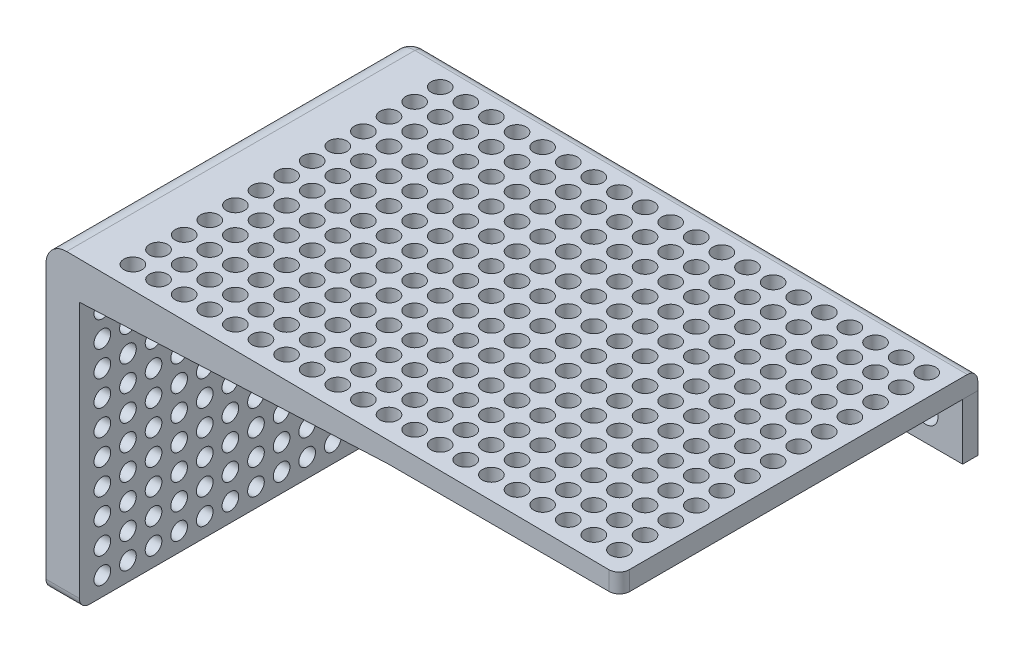
from build123d import *

# Parameters (mm, degrees)
BOSS_EXTRUDE1_DEPTH = 3.81
SKETCH3_R           = 3.048
CUT_EXTRUDE1_DEPTH  = 5.08
BOSS_EXTRUDE3_DEPTH = 88.9
SKETCH13_R          = 2.066220198
CUT_EXTRUDE5_DEPTH  = 8.382
FILLET1_R           = 5.08
SKETCH11_W          = 17.734275282
SKETCH11_H          = 29.748307676
SKETCH11_H_2        = 6.473099961
CUT_EXTRUDE6_DEPTH  = 8.382
FILLET2_R           = 2.54
SKETCH12_R          = 2.251335549
CUT_EXTRUDE8_DEPTH  = 10.668


with BuildPart() as part:
    # Sketch2 → Boss-Extrude1 (new body)
    with BuildSketch(Plane.XY):
        Polygon((0, 0), (19.05, 0), (19.05, 48.381202876), (76.506116443, 55.792162409), (133.961624595, 55.792162409), (133.961624595, 69.711099336), (76.506116443, 69.711099336), (0, 66.161202876), align=None)
    extrude(amount=BOSS_EXTRUDE1_DEPTH)

    # Sketch3 → Cut-Extrude1 (cut)
    with BuildSketch(Plane.XY.offset(3.81)):
        with Locations((12.573, 55.590515547)):
            Circle(SKETCH3_R)
        with Locations((68.406077338, 61.559515547)):
            Circle(SKETCH3_R)
        with Locations((9.525, 12.283515547)):
            Circle(SKETCH3_R)
        with Locations((124.794077338, 62.829515547)):
            Circle(SKETCH3_R)
    extrude(amount=-CUT_EXTRUDE1_DEPTH, mode=Mode.SUBTRACT)

    # Sketch11 → Cut-Extrude6 (cut)
    with BuildSketch(Plane.XY.offset(3.81)):
        with Locations((10.182862359, 33.507049038)):
            Rectangle(SKETCH11_W, SKETCH11_H)
        with Locations((10.182862359, 3.236549981)):
            Rectangle(SKETCH11_W, SKETCH11_H_2)
    extrude(amount=-CUT_EXTRUDE6_DEPTH, mode=Mode.SUBTRACT)


with BuildPart() as body_2:
    # Sketch6 → Boss-Extrude3 (new body)
    with BuildSketch(Plane(origin=(0, 0, 0), x_dir=(-1, 0, 0), z_dir=(0, 0, -1))):
        Polygon((0, 66.161202876), (0, 0), (8.252290324, 0), (8.252290324, 75.514615039), (-133.836505972, 74.357932411), (-133.961624595, 69.711099336), (-76.506116443, 69.711099336), align=None)
    extrude(amount=-BOSS_EXTRUDE3_DEPTH)

    # Sketch13 → Cut-Extrude5 (cut)
    with BuildSketch(Plane.ZY.offset(8.252290324)):
        with Locations((6.984688979, 4.65519234)):
            Circle(SKETCH13_R)
        with Locations((13.334688979, 4.65519234)):
            Circle(SKETCH13_R)
        with Locations((19.684688979, 4.65519234)):
            Circle(SKETCH13_R)
        with Locations((26.034688979, 4.65519234)):
            Circle(SKETCH13_R)
        with Locations((32.384688979, 4.65519234)):
            Circle(SKETCH13_R)
        with Locations((38.734688979, 4.65519234)):
            Circle(SKETCH13_R)
        with Locations((45.084688979, 4.65519234)):
            Circle(SKETCH13_R)
        with Locations((51.434688979, 4.65519234)):
            Circle(SKETCH13_R)
        with Locations((57.784688979, 4.65519234)):
            Circle(SKETCH13_R)
        with Locations((64.134688979, 4.65519234)):
            Circle(SKETCH13_R)
        with Locations((70.484688979, 4.65519234)):
            Circle(SKETCH13_R)
        with Locations((76.834688979, 4.65519234)):
            Circle(SKETCH13_R)
        with Locations((83.184688979, 4.65519234)):
            Circle(SKETCH13_R)
        with Locations((13.334688979, 11.00519234)):
            Circle(SKETCH13_R)
        with Locations((19.684688979, 11.00519234)):
            Circle(SKETCH13_R)
        with Locations((26.034688979, 11.00519234)):
            Circle(SKETCH13_R)
        with Locations((32.384688979, 11.00519234)):
            Circle(SKETCH13_R)
        with Locations((38.734688979, 11.00519234)):
            Circle(SKETCH13_R)
        with Locations((45.084688979, 11.00519234)):
            Circle(SKETCH13_R)
        with Locations((51.434688979, 11.00519234)):
            Circle(SKETCH13_R)
        with Locations((57.784688979, 11.00519234)):
            Circle(SKETCH13_R)
        with Locations((64.134688979, 11.00519234)):
            Circle(SKETCH13_R)
        with Locations((70.484688979, 11.00519234)):
            Circle(SKETCH13_R)
        with Locations((76.834688979, 11.00519234)):
            Circle(SKETCH13_R)
        with Locations((83.184688979, 11.00519234)):
            Circle(SKETCH13_R)
        with Locations((13.334688979, 17.35519234)):
            Circle(SKETCH13_R)
        with Locations((19.684688979, 17.35519234)):
            Circle(SKETCH13_R)
        with Locations((26.034688979, 17.35519234)):
            Circle(SKETCH13_R)
        with Locations((32.384688979, 17.35519234)):
            Circle(SKETCH13_R)
        with Locations((38.734688979, 17.35519234)):
            Circle(SKETCH13_R)
        with Locations((45.084688979, 17.35519234)):
            Circle(SKETCH13_R)
        with Locations((51.434688979, 17.35519234)):
            Circle(SKETCH13_R)
        with Locations((57.784688979, 17.35519234)):
            Circle(SKETCH13_R)
        with Locations((64.134688979, 17.35519234)):
            Circle(SKETCH13_R)
        with Locations((70.484688979, 17.35519234)):
            Circle(SKETCH13_R)
        with Locations((76.834688979, 17.35519234)):
            Circle(SKETCH13_R)
        with Locations((83.184688979, 17.35519234)):
            Circle(SKETCH13_R)
        with Locations((13.334688979, 23.70519234)):
            Circle(SKETCH13_R)
        with Locations((19.684688979, 23.70519234)):
            Circle(SKETCH13_R)
        with Locations((26.034688979, 23.70519234)):
            Circle(SKETCH13_R)
        with Locations((32.384688979, 23.70519234)):
            Circle(SKETCH13_R)
        with Locations((38.734688979, 23.70519234)):
            Circle(SKETCH13_R)
        with Locations((45.084688979, 23.70519234)):
            Circle(SKETCH13_R)
        with Locations((51.434688979, 23.70519234)):
            Circle(SKETCH13_R)
        with Locations((57.784688979, 23.70519234)):
            Circle(SKETCH13_R)
        with Locations((64.134688979, 23.70519234)):
            Circle(SKETCH13_R)
        with Locations((70.484688979, 23.70519234)):
            Circle(SKETCH13_R)
        with Locations((76.834688979, 23.70519234)):
            Circle(SKETCH13_R)
        with Locations((83.184688979, 23.70519234)):
            Circle(SKETCH13_R)
        with Locations((13.334688979, 30.05519234)):
            Circle(SKETCH13_R)
        with Locations((19.684688979, 30.05519234)):
            Circle(SKETCH13_R)
        with Locations((26.034688979, 30.05519234)):
            Circle(SKETCH13_R)
        with Locations((32.384688979, 30.05519234)):
            Circle(SKETCH13_R)
        with Locations((38.734688979, 30.05519234)):
            Circle(SKETCH13_R)
        with Locations((45.084688979, 30.05519234)):
            Circle(SKETCH13_R)
        with Locations((51.434688979, 30.05519234)):
            Circle(SKETCH13_R)
        with Locations((57.784688979, 30.05519234)):
            Circle(SKETCH13_R)
        with Locations((64.134688979, 30.05519234)):
            Circle(SKETCH13_R)
        with Locations((70.484688979, 30.05519234)):
            Circle(SKETCH13_R)
        with Locations((76.834688979, 30.05519234)):
            Circle(SKETCH13_R)
        with Locations((83.184688979, 30.05519234)):
            Circle(SKETCH13_R)
        with Locations((13.334688979, 36.40519234)):
            Circle(SKETCH13_R)
        with Locations((19.684688979, 36.40519234)):
            Circle(SKETCH13_R)
        with Locations((26.034688979, 36.40519234)):
            Circle(SKETCH13_R)
        with Locations((32.384688979, 36.40519234)):
            Circle(SKETCH13_R)
        with Locations((38.734688979, 36.40519234)):
            Circle(SKETCH13_R)
        with Locations((45.084688979, 36.40519234)):
            Circle(SKETCH13_R)
        with Locations((51.434688979, 36.40519234)):
            Circle(SKETCH13_R)
        with Locations((57.784688979, 36.40519234)):
            Circle(SKETCH13_R)
        with Locations((64.134688979, 36.40519234)):
            Circle(SKETCH13_R)
        with Locations((70.484688979, 36.40519234)):
            Circle(SKETCH13_R)
        with Locations((76.834688979, 36.40519234)):
            Circle(SKETCH13_R)
        with Locations((83.184688979, 36.40519234)):
            Circle(SKETCH13_R)
        with Locations((13.334688979, 42.75519234)):
            Circle(SKETCH13_R)
        with Locations((19.684688979, 42.75519234)):
            Circle(SKETCH13_R)
        with Locations((26.034688979, 42.75519234)):
            Circle(SKETCH13_R)
        with Locations((32.384688979, 42.75519234)):
            Circle(SKETCH13_R)
        with Locations((38.734688979, 42.75519234)):
            Circle(SKETCH13_R)
        with Locations((45.084688979, 42.75519234)):
            Circle(SKETCH13_R)
        with Locations((51.434688979, 42.75519234)):
            Circle(SKETCH13_R)
        with Locations((57.784688979, 42.75519234)):
            Circle(SKETCH13_R)
        with Locations((64.134688979, 42.75519234)):
            Circle(SKETCH13_R)
        with Locations((70.484688979, 42.75519234)):
            Circle(SKETCH13_R)
        with Locations((76.834688979, 42.75519234)):
            Circle(SKETCH13_R)
        with Locations((83.184688979, 42.75519234)):
            Circle(SKETCH13_R)
        with Locations((13.334688979, 49.10519234)):
            Circle(SKETCH13_R)
        with Locations((19.684688979, 49.10519234)):
            Circle(SKETCH13_R)
        with Locations((26.034688979, 49.10519234)):
            Circle(SKETCH13_R)
        with Locations((32.384688979, 49.10519234)):
            Circle(SKETCH13_R)
        with Locations((38.734688979, 49.10519234)):
            Circle(SKETCH13_R)
        with Locations((45.084688979, 49.10519234)):
            Circle(SKETCH13_R)
        with Locations((51.434688979, 49.10519234)):
            Circle(SKETCH13_R)
        with Locations((57.784688979, 49.10519234)):
            Circle(SKETCH13_R)
        with Locations((64.134688979, 49.10519234)):
            Circle(SKETCH13_R)
        with Locations((70.484688979, 49.10519234)):
            Circle(SKETCH13_R)
        with Locations((76.834688979, 49.10519234)):
            Circle(SKETCH13_R)
        with Locations((83.184688979, 49.10519234)):
            Circle(SKETCH13_R)
        with Locations((13.334688979, 55.45519234)):
            Circle(SKETCH13_R)
        with Locations((19.684688979, 55.45519234)):
            Circle(SKETCH13_R)
        with Locations((26.034688979, 55.45519234)):
            Circle(SKETCH13_R)
        with Locations((32.384688979, 55.45519234)):
            Circle(SKETCH13_R)
        with Locations((38.734688979, 55.45519234)):
            Circle(SKETCH13_R)
        with Locations((45.084688979, 55.45519234)):
            Circle(SKETCH13_R)
        with Locations((51.434688979, 55.45519234)):
            Circle(SKETCH13_R)
        with Locations((57.784688979, 55.45519234)):
            Circle(SKETCH13_R)
        with Locations((64.134688979, 55.45519234)):
            Circle(SKETCH13_R)
        with Locations((70.484688979, 55.45519234)):
            Circle(SKETCH13_R)
        with Locations((76.834688979, 55.45519234)):
            Circle(SKETCH13_R)
        with Locations((83.184688979, 55.45519234)):
            Circle(SKETCH13_R)
        with Locations((13.334688979, 61.80519234)):
            Circle(SKETCH13_R)
        with Locations((19.684688979, 61.80519234)):
            Circle(SKETCH13_R)
        with Locations((26.034688979, 61.80519234)):
            Circle(SKETCH13_R)
        with Locations((32.384688979, 61.80519234)):
            Circle(SKETCH13_R)
        with Locations((38.734688979, 61.80519234)):
            Circle(SKETCH13_R)
        with Locations((45.084688979, 61.80519234)):
            Circle(SKETCH13_R)
        with Locations((51.434688979, 61.80519234)):
            Circle(SKETCH13_R)
        with Locations((57.784688979, 61.80519234)):
            Circle(SKETCH13_R)
        with Locations((64.134688979, 61.80519234)):
            Circle(SKETCH13_R)
        with Locations((70.484688979, 61.80519234)):
            Circle(SKETCH13_R)
        with Locations((76.834688979, 61.80519234)):
            Circle(SKETCH13_R)
        with Locations((83.184688979, 61.80519234)):
            Circle(SKETCH13_R)
        with Locations((6.984688979, 11.00519234)):
            Circle(SKETCH13_R)
        with Locations((6.984688979, 17.35519234)):
            Circle(SKETCH13_R)
        with Locations((6.984688979, 23.70519234)):
            Circle(SKETCH13_R)
        with Locations((6.984688979, 30.05519234)):
            Circle(SKETCH13_R)
        with Locations((6.984688979, 36.40519234)):
            Circle(SKETCH13_R)
        with Locations((6.984688979, 42.75519234)):
            Circle(SKETCH13_R)
        with Locations((6.984688979, 49.10519234)):
            Circle(SKETCH13_R)
        with Locations((6.984688979, 55.45519234)):
            Circle(SKETCH13_R)
        with Locations((6.984688979, 61.80519234)):
            Circle(SKETCH13_R)
    extrude(amount=-CUT_EXTRUDE5_DEPTH, mode=Mode.SUBTRACT)

    # Fillet1
    fillet1_edges = [body_2.edges().sort_by_distance(p)[0] for p in [
        (-8.252290324, 75.514615039, 44.45),
    ]]
    fillet(fillet1_edges, radius=FILLET1_R)

    # Fillet2
    fillet2_edges = [body_2.edges().sort_by_distance(p)[0] for p in [
        (-8.252290324, 35.196546333, 0),
        (-6.749742516, 73.999785862, 0),
        (-4.126145162, 0, 88.9),
        (65.352784166, 74.915428381, 0),
        (133.899065284, 72.034515873, 88.9),
    ]]
    fillet(fillet2_edges, radius=FILLET2_R)

    # Sketch12 → Cut-Extrude8 (cut)
    with BuildSketch(Plane(origin=(0.614143824, 75.442437284, 0), x_dir=(0.9999668672734643, -0.0081402920889802, 0), z_dir=(0.0081402920889802, 0.9999668672734644, 0))):
        with Locations((127.816375398, -7.177579688)):
            Circle(SKETCH12_R)
        with Locations((121.466375398, -7.177579688)):
            Circle(SKETCH12_R)
        with Locations((115.116375398, -7.177579688)):
            Circle(SKETCH12_R)
        with Locations((108.766375398, -7.177579688)):
            Circle(SKETCH12_R)
        with Locations((102.416375398, -7.177579688)):
            Circle(SKETCH12_R)
        with Locations((96.066375398, -7.177579688)):
            Circle(SKETCH12_R)
        with Locations((89.716375398, -7.177579688)):
            Circle(SKETCH12_R)
        with Locations((83.366375398, -7.177579688)):
            Circle(SKETCH12_R)
        with Locations((77.016375398, -7.177579688)):
            Circle(SKETCH12_R)
        with Locations((70.666375398, -7.177579688)):
            Circle(SKETCH12_R)
        with Locations((64.316375398, -7.177579688)):
            Circle(SKETCH12_R)
        with Locations((57.966375398, -7.177579688)):
            Circle(SKETCH12_R)
        with Locations((51.616375398, -7.177579688)):
            Circle(SKETCH12_R)
        with Locations((45.266375398, -7.177579688)):
            Circle(SKETCH12_R)
        with Locations((38.916375398, -7.177579688)):
            Circle(SKETCH12_R)
        with Locations((32.566375398, -7.177579688)):
            Circle(SKETCH12_R)
        with Locations((26.216375398, -7.177579688)):
            Circle(SKETCH12_R)
        with Locations((19.866375398, -7.177579688)):
            Circle(SKETCH12_R)
        with Locations((13.516375398, -7.177579688)):
            Circle(SKETCH12_R)
        with Locations((7.166375398, -7.177579688)):
            Circle(SKETCH12_R)
        with Locations((121.466375398, -13.527579688)):
            Circle(SKETCH12_R)
        with Locations((115.116375398, -13.527579688)):
            Circle(SKETCH12_R)
        with Locations((108.766375398, -13.527579688)):
            Circle(SKETCH12_R)
        with Locations((102.416375398, -13.527579688)):
            Circle(SKETCH12_R)
        with Locations((96.066375398, -13.527579688)):
            Circle(SKETCH12_R)
        with Locations((89.716375398, -13.527579688)):
            Circle(SKETCH12_R)
        with Locations((83.366375398, -13.527579688)):
            Circle(SKETCH12_R)
        with Locations((77.016375398, -13.527579688)):
            Circle(SKETCH12_R)
        with Locations((70.666375398, -13.527579688)):
            Circle(SKETCH12_R)
        with Locations((64.316375398, -13.527579688)):
            Circle(SKETCH12_R)
        with Locations((57.966375398, -13.527579688)):
            Circle(SKETCH12_R)
        with Locations((51.616375398, -13.527579688)):
            Circle(SKETCH12_R)
        with Locations((45.266375398, -13.527579688)):
            Circle(SKETCH12_R)
        with Locations((38.916375398, -13.527579688)):
            Circle(SKETCH12_R)
        with Locations((32.566375398, -13.527579688)):
            Circle(SKETCH12_R)
        with Locations((26.216375398, -13.527579688)):
            Circle(SKETCH12_R)
        with Locations((19.866375398, -13.527579688)):
            Circle(SKETCH12_R)
        with Locations((13.516375398, -13.527579688)):
            Circle(SKETCH12_R)
        with Locations((7.166375398, -13.527579688)):
            Circle(SKETCH12_R)
        with Locations((121.466375398, -19.877579688)):
            Circle(SKETCH12_R)
        with Locations((115.116375398, -19.877579688)):
            Circle(SKETCH12_R)
        with Locations((108.766375398, -19.877579688)):
            Circle(SKETCH12_R)
        with Locations((102.416375398, -19.877579688)):
            Circle(SKETCH12_R)
        with Locations((96.066375398, -19.877579688)):
            Circle(SKETCH12_R)
        with Locations((89.716375398, -19.877579688)):
            Circle(SKETCH12_R)
        with Locations((83.366375398, -19.877579688)):
            Circle(SKETCH12_R)
        with Locations((77.016375398, -19.877579688)):
            Circle(SKETCH12_R)
        with Locations((70.666375398, -19.877579688)):
            Circle(SKETCH12_R)
        with Locations((64.316375398, -19.877579688)):
            Circle(SKETCH12_R)
        with Locations((57.966375398, -19.877579688)):
            Circle(SKETCH12_R)
        with Locations((51.616375398, -19.877579688)):
            Circle(SKETCH12_R)
        with Locations((45.266375398, -19.877579688)):
            Circle(SKETCH12_R)
        with Locations((38.916375398, -19.877579688)):
            Circle(SKETCH12_R)
        with Locations((32.566375398, -19.877579688)):
            Circle(SKETCH12_R)
        with Locations((26.216375398, -19.877579688)):
            Circle(SKETCH12_R)
        with Locations((19.866375398, -19.877579688)):
            Circle(SKETCH12_R)
        with Locations((13.516375398, -19.877579688)):
            Circle(SKETCH12_R)
        with Locations((7.166375398, -19.877579688)):
            Circle(SKETCH12_R)
        with Locations((121.466375398, -26.227579688)):
            Circle(SKETCH12_R)
        with Locations((115.116375398, -26.227579688)):
            Circle(SKETCH12_R)
        with Locations((108.766375398, -26.227579688)):
            Circle(SKETCH12_R)
        with Locations((102.416375398, -26.227579688)):
            Circle(SKETCH12_R)
        with Locations((96.066375398, -26.227579688)):
            Circle(SKETCH12_R)
        with Locations((89.716375398, -26.227579688)):
            Circle(SKETCH12_R)
        with Locations((83.366375398, -26.227579688)):
            Circle(SKETCH12_R)
        with Locations((77.016375398, -26.227579688)):
            Circle(SKETCH12_R)
        with Locations((70.666375398, -26.227579688)):
            Circle(SKETCH12_R)
        with Locations((64.316375398, -26.227579688)):
            Circle(SKETCH12_R)
        with Locations((57.966375398, -26.227579688)):
            Circle(SKETCH12_R)
        with Locations((51.616375398, -26.227579688)):
            Circle(SKETCH12_R)
        with Locations((45.266375398, -26.227579688)):
            Circle(SKETCH12_R)
        with Locations((38.916375398, -26.227579688)):
            Circle(SKETCH12_R)
        with Locations((32.566375398, -26.227579688)):
            Circle(SKETCH12_R)
        with Locations((26.216375398, -26.227579688)):
            Circle(SKETCH12_R)
        with Locations((19.866375398, -26.227579688)):
            Circle(SKETCH12_R)
        with Locations((13.516375398, -26.227579688)):
            Circle(SKETCH12_R)
        with Locations((7.166375398, -26.227579688)):
            Circle(SKETCH12_R)
        with Locations((121.466375398, -32.577579688)):
            Circle(SKETCH12_R)
        with Locations((115.116375398, -32.577579688)):
            Circle(SKETCH12_R)
        with Locations((108.766375398, -32.577579688)):
            Circle(SKETCH12_R)
        with Locations((102.416375398, -32.577579688)):
            Circle(SKETCH12_R)
        with Locations((96.066375398, -32.577579688)):
            Circle(SKETCH12_R)
        with Locations((89.716375398, -32.577579688)):
            Circle(SKETCH12_R)
        with Locations((83.366375398, -32.577579688)):
            Circle(SKETCH12_R)
        with Locations((77.016375398, -32.577579688)):
            Circle(SKETCH12_R)
        with Locations((70.666375398, -32.577579688)):
            Circle(SKETCH12_R)
        with Locations((64.316375398, -32.577579688)):
            Circle(SKETCH12_R)
        with Locations((57.966375398, -32.577579688)):
            Circle(SKETCH12_R)
        with Locations((51.616375398, -32.577579688)):
            Circle(SKETCH12_R)
        with Locations((45.266375398, -32.577579688)):
            Circle(SKETCH12_R)
        with Locations((38.916375398, -32.577579688)):
            Circle(SKETCH12_R)
        with Locations((32.566375398, -32.577579688)):
            Circle(SKETCH12_R)
        with Locations((26.216375398, -32.577579688)):
            Circle(SKETCH12_R)
        with Locations((19.866375398, -32.577579688)):
            Circle(SKETCH12_R)
        with Locations((13.516375398, -32.577579688)):
            Circle(SKETCH12_R)
        with Locations((7.166375398, -32.577579688)):
            Circle(SKETCH12_R)
        with Locations((121.466375398, -38.927579688)):
            Circle(SKETCH12_R)
        with Locations((115.116375398, -38.927579688)):
            Circle(SKETCH12_R)
        with Locations((108.766375398, -38.927579688)):
            Circle(SKETCH12_R)
        with Locations((102.416375398, -38.927579688)):
            Circle(SKETCH12_R)
        with Locations((96.066375398, -38.927579688)):
            Circle(SKETCH12_R)
        with Locations((89.716375398, -38.927579688)):
            Circle(SKETCH12_R)
        with Locations((83.366375398, -38.927579688)):
            Circle(SKETCH12_R)
        with Locations((77.016375398, -38.927579688)):
            Circle(SKETCH12_R)
        with Locations((70.666375398, -38.927579688)):
            Circle(SKETCH12_R)
        with Locations((64.316375398, -38.927579688)):
            Circle(SKETCH12_R)
        with Locations((57.966375398, -38.927579688)):
            Circle(SKETCH12_R)
        with Locations((51.616375398, -38.927579688)):
            Circle(SKETCH12_R)
        with Locations((45.266375398, -38.927579688)):
            Circle(SKETCH12_R)
        with Locations((38.916375398, -38.927579688)):
            Circle(SKETCH12_R)
        with Locations((32.566375398, -38.927579688)):
            Circle(SKETCH12_R)
        with Locations((26.216375398, -38.927579688)):
            Circle(SKETCH12_R)
        with Locations((19.866375398, -38.927579688)):
            Circle(SKETCH12_R)
        with Locations((13.516375398, -38.927579688)):
            Circle(SKETCH12_R)
        with Locations((7.166375398, -38.927579688)):
            Circle(SKETCH12_R)
        with Locations((121.466375398, -45.277579688)):
            Circle(SKETCH12_R)
        with Locations((115.116375398, -45.277579688)):
            Circle(SKETCH12_R)
        with Locations((108.766375398, -45.277579688)):
            Circle(SKETCH12_R)
        with Locations((102.416375398, -45.277579688)):
            Circle(SKETCH12_R)
        with Locations((96.066375398, -45.277579688)):
            Circle(SKETCH12_R)
        with Locations((89.716375398, -45.277579688)):
            Circle(SKETCH12_R)
        with Locations((83.366375398, -45.277579688)):
            Circle(SKETCH12_R)
        with Locations((77.016375398, -45.277579688)):
            Circle(SKETCH12_R)
        with Locations((70.666375398, -45.277579688)):
            Circle(SKETCH12_R)
        with Locations((64.316375398, -45.277579688)):
            Circle(SKETCH12_R)
        with Locations((57.966375398, -45.277579688)):
            Circle(SKETCH12_R)
        with Locations((51.616375398, -45.277579688)):
            Circle(SKETCH12_R)
        with Locations((45.266375398, -45.277579688)):
            Circle(SKETCH12_R)
        with Locations((38.916375398, -45.277579688)):
            Circle(SKETCH12_R)
        with Locations((32.566375398, -45.277579688)):
            Circle(SKETCH12_R)
        with Locations((26.216375398, -45.277579688)):
            Circle(SKETCH12_R)
        with Locations((19.866375398, -45.277579688)):
            Circle(SKETCH12_R)
        with Locations((13.516375398, -45.277579688)):
            Circle(SKETCH12_R)
        with Locations((7.166375398, -45.277579688)):
            Circle(SKETCH12_R)
        with Locations((121.466375398, -51.627579688)):
            Circle(SKETCH12_R)
        with Locations((115.116375398, -51.627579688)):
            Circle(SKETCH12_R)
        with Locations((108.766375398, -51.627579688)):
            Circle(SKETCH12_R)
        with Locations((102.416375398, -51.627579688)):
            Circle(SKETCH12_R)
        with Locations((96.066375398, -51.627579688)):
            Circle(SKETCH12_R)
        with Locations((89.716375398, -51.627579688)):
            Circle(SKETCH12_R)
        with Locations((83.366375398, -51.627579688)):
            Circle(SKETCH12_R)
        with Locations((77.016375398, -51.627579688)):
            Circle(SKETCH12_R)
        with Locations((70.666375398, -51.627579688)):
            Circle(SKETCH12_R)
        with Locations((64.316375398, -51.627579688)):
            Circle(SKETCH12_R)
        with Locations((57.966375398, -51.627579688)):
            Circle(SKETCH12_R)
        with Locations((51.616375398, -51.627579688)):
            Circle(SKETCH12_R)
        with Locations((45.266375398, -51.627579688)):
            Circle(SKETCH12_R)
        with Locations((38.916375398, -51.627579688)):
            Circle(SKETCH12_R)
        with Locations((32.566375398, -51.627579688)):
            Circle(SKETCH12_R)
        with Locations((26.216375398, -51.627579688)):
            Circle(SKETCH12_R)
        with Locations((19.866375398, -51.627579688)):
            Circle(SKETCH12_R)
        with Locations((13.516375398, -51.627579688)):
            Circle(SKETCH12_R)
        with Locations((7.166375398, -51.627579688)):
            Circle(SKETCH12_R)
        with Locations((121.466375398, -57.977579688)):
            Circle(SKETCH12_R)
        with Locations((115.116375398, -57.977579688)):
            Circle(SKETCH12_R)
        with Locations((108.766375398, -57.977579688)):
            Circle(SKETCH12_R)
        with Locations((102.416375398, -57.977579688)):
            Circle(SKETCH12_R)
        with Locations((96.066375398, -57.977579688)):
            Circle(SKETCH12_R)
        with Locations((89.716375398, -57.977579688)):
            Circle(SKETCH12_R)
        with Locations((83.366375398, -57.977579688)):
            Circle(SKETCH12_R)
        with Locations((77.016375398, -57.977579688)):
            Circle(SKETCH12_R)
        with Locations((70.666375398, -57.977579688)):
            Circle(SKETCH12_R)
        with Locations((64.316375398, -57.977579688)):
            Circle(SKETCH12_R)
        with Locations((57.966375398, -57.977579688)):
            Circle(SKETCH12_R)
        with Locations((51.616375398, -57.977579688)):
            Circle(SKETCH12_R)
        with Locations((45.266375398, -57.977579688)):
            Circle(SKETCH12_R)
        with Locations((38.916375398, -57.977579688)):
            Circle(SKETCH12_R)
        with Locations((32.566375398, -57.977579688)):
            Circle(SKETCH12_R)
        with Locations((26.216375398, -57.977579688)):
            Circle(SKETCH12_R)
        with Locations((19.866375398, -57.977579688)):
            Circle(SKETCH12_R)
        with Locations((13.516375398, -57.977579688)):
            Circle(SKETCH12_R)
        with Locations((7.166375398, -57.977579688)):
            Circle(SKETCH12_R)
        with Locations((121.466375398, -64.327579688)):
            Circle(SKETCH12_R)
        with Locations((115.116375398, -64.327579688)):
            Circle(SKETCH12_R)
        with Locations((108.766375398, -64.327579688)):
            Circle(SKETCH12_R)
        with Locations((102.416375398, -64.327579688)):
            Circle(SKETCH12_R)
        with Locations((96.066375398, -64.327579688)):
            Circle(SKETCH12_R)
        with Locations((89.716375398, -64.327579688)):
            Circle(SKETCH12_R)
        with Locations((83.366375398, -64.327579688)):
            Circle(SKETCH12_R)
        with Locations((77.016375398, -64.327579688)):
            Circle(SKETCH12_R)
        with Locations((70.666375398, -64.327579688)):
            Circle(SKETCH12_R)
        with Locations((64.316375398, -64.327579688)):
            Circle(SKETCH12_R)
        with Locations((57.966375398, -64.327579688)):
            Circle(SKETCH12_R)
        with Locations((51.616375398, -64.327579688)):
            Circle(SKETCH12_R)
        with Locations((45.266375398, -64.327579688)):
            Circle(SKETCH12_R)
        with Locations((38.916375398, -64.327579688)):
            Circle(SKETCH12_R)
        with Locations((32.566375398, -64.327579688)):
            Circle(SKETCH12_R)
        with Locations((26.216375398, -64.327579688)):
            Circle(SKETCH12_R)
        with Locations((19.866375398, -64.327579688)):
            Circle(SKETCH12_R)
        with Locations((13.516375398, -64.327579688)):
            Circle(SKETCH12_R)
        with Locations((7.166375398, -64.327579688)):
            Circle(SKETCH12_R)
        with Locations((121.466375398, -70.677579688)):
            Circle(SKETCH12_R)
        with Locations((115.116375398, -70.677579688)):
            Circle(SKETCH12_R)
        with Locations((108.766375398, -70.677579688)):
            Circle(SKETCH12_R)
        with Locations((102.416375398, -70.677579688)):
            Circle(SKETCH12_R)
        with Locations((96.066375398, -70.677579688)):
            Circle(SKETCH12_R)
        with Locations((89.716375398, -70.677579688)):
            Circle(SKETCH12_R)
        with Locations((83.366375398, -70.677579688)):
            Circle(SKETCH12_R)
        with Locations((77.016375398, -70.677579688)):
            Circle(SKETCH12_R)
        with Locations((70.666375398, -70.677579688)):
            Circle(SKETCH12_R)
        with Locations((64.316375398, -70.677579688)):
            Circle(SKETCH12_R)
        with Locations((57.966375398, -70.677579688)):
            Circle(SKETCH12_R)
        with Locations((51.616375398, -70.677579688)):
            Circle(SKETCH12_R)
        with Locations((45.266375398, -70.677579688)):
            Circle(SKETCH12_R)
        with Locations((38.916375398, -70.677579688)):
            Circle(SKETCH12_R)
        with Locations((32.566375398, -70.677579688)):
            Circle(SKETCH12_R)
        with Locations((26.216375398, -70.677579688)):
            Circle(SKETCH12_R)
        with Locations((19.866375398, -70.677579688)):
            Circle(SKETCH12_R)
        with Locations((13.516375398, -70.677579688)):
            Circle(SKETCH12_R)
        with Locations((7.166375398, -70.677579688)):
            Circle(SKETCH12_R)
        with Locations((121.466375398, -77.027579688)):
            Circle(SKETCH12_R)
        with Locations((115.116375398, -77.027579688)):
            Circle(SKETCH12_R)
        with Locations((108.766375398, -77.027579688)):
            Circle(SKETCH12_R)
        with Locations((102.416375398, -77.027579688)):
            Circle(SKETCH12_R)
        with Locations((96.066375398, -77.027579688)):
            Circle(SKETCH12_R)
        with Locations((89.716375398, -77.027579688)):
            Circle(SKETCH12_R)
        with Locations((83.366375398, -77.027579688)):
            Circle(SKETCH12_R)
        with Locations((77.016375398, -77.027579688)):
            Circle(SKETCH12_R)
        with Locations((70.666375398, -77.027579688)):
            Circle(SKETCH12_R)
        with Locations((64.316375398, -77.027579688)):
            Circle(SKETCH12_R)
        with Locations((57.966375398, -77.027579688)):
            Circle(SKETCH12_R)
        with Locations((51.616375398, -77.027579688)):
            Circle(SKETCH12_R)
        with Locations((45.266375398, -77.027579688)):
            Circle(SKETCH12_R)
        with Locations((38.916375398, -77.027579688)):
            Circle(SKETCH12_R)
        with Locations((32.566375398, -77.027579688)):
            Circle(SKETCH12_R)
        with Locations((26.216375398, -77.027579688)):
            Circle(SKETCH12_R)
        with Locations((19.866375398, -77.027579688)):
            Circle(SKETCH12_R)
        with Locations((13.516375398, -77.027579688)):
            Circle(SKETCH12_R)
        with Locations((7.166375398, -77.027579688)):
            Circle(SKETCH12_R)
        with Locations((121.466375398, -83.377579688)):
            Circle(SKETCH12_R)
        with Locations((115.116375398, -83.377579688)):
            Circle(SKETCH12_R)
        with Locations((108.766375398, -83.377579688)):
            Circle(SKETCH12_R)
        with Locations((102.416375398, -83.377579688)):
            Circle(SKETCH12_R)
        with Locations((96.066375398, -83.377579688)):
            Circle(SKETCH12_R)
        with Locations((89.716375398, -83.377579688)):
            Circle(SKETCH12_R)
        with Locations((83.366375398, -83.377579688)):
            Circle(SKETCH12_R)
        with Locations((77.016375398, -83.377579688)):
            Circle(SKETCH12_R)
        with Locations((70.666375398, -83.377579688)):
            Circle(SKETCH12_R)
        with Locations((64.316375398, -83.377579688)):
            Circle(SKETCH12_R)
        with Locations((57.966375398, -83.377579688)):
            Circle(SKETCH12_R)
        with Locations((51.616375398, -83.377579688)):
            Circle(SKETCH12_R)
        with Locations((45.266375398, -83.377579688)):
            Circle(SKETCH12_R)
        with Locations((38.916375398, -83.377579688)):
            Circle(SKETCH12_R)
        with Locations((32.566375398, -83.377579688)):
            Circle(SKETCH12_R)
        with Locations((26.216375398, -83.377579688)):
            Circle(SKETCH12_R)
        with Locations((19.866375398, -83.377579688)):
            Circle(SKETCH12_R)
        with Locations((13.516375398, -83.377579688)):
            Circle(SKETCH12_R)
        with Locations((7.166375398, -83.377579688)):
            Circle(SKETCH12_R)
        with Locations((127.816375398, -13.527579688)):
            Circle(SKETCH12_R)
        with Locations((127.816375398, -19.877579688)):
            Circle(SKETCH12_R)
        with Locations((127.816375398, -26.227579688)):
            Circle(SKETCH12_R)
        with Locations((127.816375398, -32.577579688)):
            Circle(SKETCH12_R)
        with Locations((127.816375398, -38.927579688)):
            Circle(SKETCH12_R)
        with Locations((127.816375398, -45.277579688)):
            Circle(SKETCH12_R)
        with Locations((127.816375398, -51.627579688)):
            Circle(SKETCH12_R)
        with Locations((127.816375398, -57.977579688)):
            Circle(SKETCH12_R)
        with Locations((127.816375398, -64.327579688)):
            Circle(SKETCH12_R)
        with Locations((127.816375398, -70.677579688)):
            Circle(SKETCH12_R)
        with Locations((127.816375398, -77.027579688)):
            Circle(SKETCH12_R)
        with Locations((127.816375398, -83.377579688)):
            Circle(SKETCH12_R)
    extrude(amount=-CUT_EXTRUDE8_DEPTH, mode=Mode.SUBTRACT)


solid = Compound([part.part, body_2.part])
